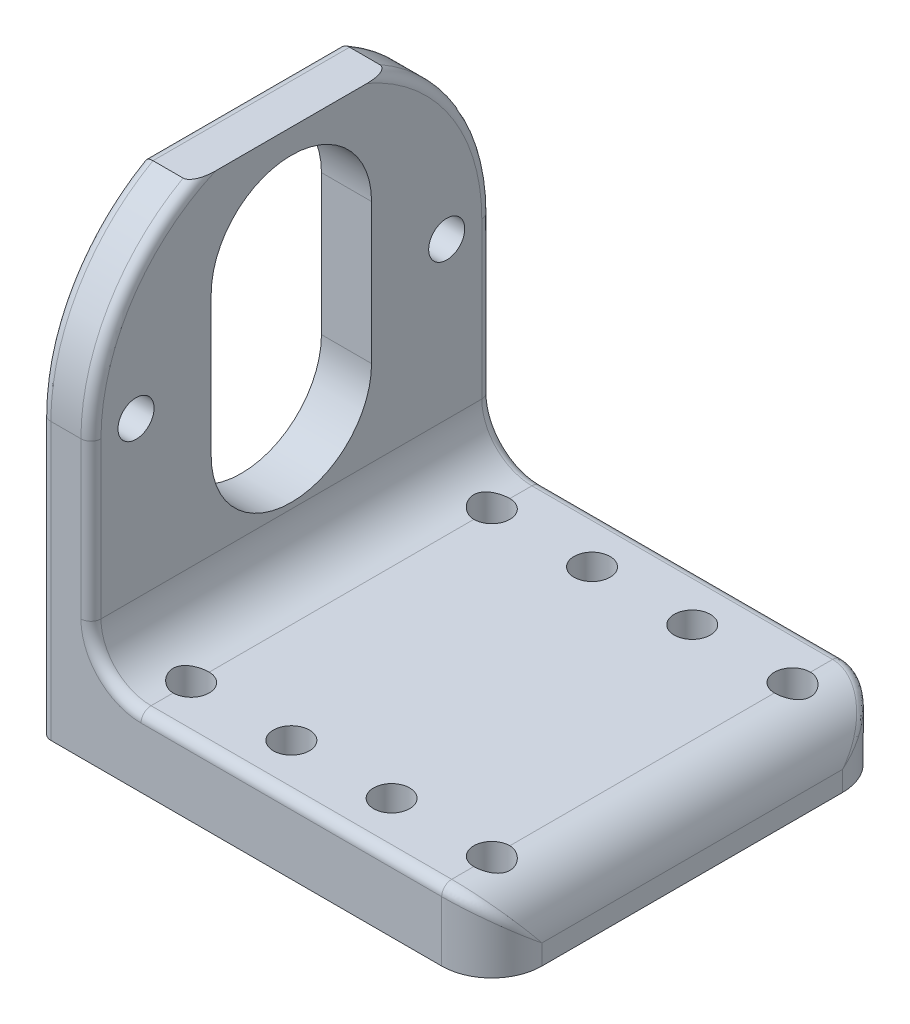
from build123d import *

# Parameters (mm, degrees)
SKETCH1_W           = 40
SKETCH1_H           = 40
SKETCH1_R           = 1.8
BOSS_EXTRUDE1_DEPTH = 7
SKETCH1_3_W         = 5
SKETCH1_3_H         = 40
BOSS_EXTRUDE2_DEPTH = 45
SKETCH2_R           = 1.8
CUT_EXTRUDE1_DEPTH  = 67.708320321
SKETCH2_4_OUTSIDE_W = 57.034
SKETCH2_4_OUTSIDE_H = 62.034
SKETCH2_4_OUTSIDE_R = 1.8
CUT_EXTRUDE2_DEPTH  = 67.708320321
FILLET1_R           = 5
FILLET2_R           = 5
FILLET3_R           = 1


with BuildPart() as part:
    # Sketch1 → Boss-Extrude1 (new body)
    with BuildSketch(Plane(origin=(0, 0, 0), x_dir=(1, 0, 0), z_dir=(0, 1, 0))):
        Rectangle(SKETCH1_W, SKETCH1_H)
        with Locations(Location((-5, -15, 0), (0, 0, 270))):
            Circle(SKETCH1_R, mode=Mode.SUBTRACT)
        with Locations(Location((15, -15, 0), (0, 0, 270))):
            Circle(SKETCH1_R, mode=Mode.SUBTRACT)
        with Locations(Location((-15, 15, 0), (0, 0, 270))):
            Circle(SKETCH1_R, mode=Mode.SUBTRACT)
        with Locations(Location((-5, 15, 0), (0, 0, 270))):
            Circle(SKETCH1_R, mode=Mode.SUBTRACT)
        with Locations(Location((5, 15, 0), (0, 0, 270))):
            Circle(SKETCH1_R, mode=Mode.SUBTRACT)
        with Locations(Location((15, 15, 0), (0, 0, 270))):
            Circle(SKETCH1_R, mode=Mode.SUBTRACT)
        with Locations(Location((5, -15, 0), (0, 0, 270))):
            Circle(SKETCH1_R, mode=Mode.SUBTRACT)
        with Locations(Location((-15, -15, 0), (0, 0, 270))):
            Circle(SKETCH1_R, mode=Mode.SUBTRACT)
    extrude(amount=BOSS_EXTRUDE1_DEPTH)

    # Sketch1<3> → Boss-Extrude2 (add)
    with BuildSketch(Plane(origin=(0, 0, 0), x_dir=(1, 0, 0), z_dir=(0, 1, 0))):
        with Locations((-22.5, 0)):
            Rectangle(SKETCH1_3_W, SKETCH1_3_H)
    extrude(amount=BOSS_EXTRUDE2_DEPTH)

    # Sketch2 → Cut-Extrude1 (cut, through all)
    with BuildSketch(Plane.ZY.offset(25)):
        with Locations((-15.5, 27.569)):
            Circle(SKETCH2_R)
        with BuildLine():
            Line((8, 20.569), (8, 34.569))
            ThreePointArc((8, 34.569), (0, 42.569), (-8, 34.569))
            Line((-8, 34.569), (-8, 20.569))
            ThreePointArc((-8, 20.569), (0, 12.569), (8, 20.569))
        make_face()
        with Locations((15.5, 27.569)):
            Circle(SKETCH2_R)
    extrude(amount=-CUT_EXTRUDE1_DEPTH, mode=Mode.SUBTRACT)

    # Sketch2<4> outside → Cut-Extrude2 (cut, through all)
    # profile 1 of 4: a face of its own
    with BuildSketch(Plane.ZY.offset(25)):
        with Locations((0, 22.5)):
            Rectangle(SKETCH2_4_OUTSIDE_W, SKETCH2_4_OUTSIDE_H)
        with BuildLine():
            Line((-20, 27.569), (-20, 0))
            Line((-20, 0), (20, 0))
            Line((20, 0), (20, 27.569))
            ThreePointArc((20, 27.569), (0, 47.569), (-20, 27.569))
        make_face(mode=Mode.SUBTRACT)
    # profile 2 of 4: a face of its own
    with BuildSketch(Plane.ZY.offset(25)):
        with Locations((-15.5, 27.569)):
            Circle(SKETCH2_4_OUTSIDE_R)
    # profile 3 of 4: a face of its own
    with BuildSketch(Plane.ZY.offset(25)):
        with Locations((15.5, 27.569)):
            Circle(SKETCH2_4_OUTSIDE_R)
    # profile 4 of 4: a face of its own
    with BuildSketch(Plane.ZY.offset(25)):
        with BuildLine():
            Line((-8, 20.569), (-8, 34.569))
            ThreePointArc((-8, 34.569), (0, 42.569), (8, 34.569))
            Line((8, 34.569), (8, 20.569))
            ThreePointArc((8, 20.569), (0, 12.569), (-8, 20.569))
        make_face()
    extrude(amount=-CUT_EXTRUDE2_DEPTH, mode=Mode.SUBTRACT)

    # Fillet1
    # the kernel refuses this fillet: 5 mm, written as the material it adds along each edge
    with BuildSketch(Plane(origin=(-20, 7, -20), x_dir=(1, 0, 0), z_dir=(0, 0, 1))) as fillet1_piece_1_section:
        with BuildLine():
            CenterArc((FILLET1_R, FILLET1_R), FILLET1_R, 180, 90)
            Line((0, FILLET1_R), (0, 0))
            Line((0, 0), (FILLET1_R, 0))
        make_face()
    fillet1_piece_1 = extrude(amount=40, mode=Mode.PRIVATE)
    fillet1_piece_1 = fillet1_piece_1 - Plane(origin=(-15, 8.140202128, -15), x_dir=(0, 0, 1), z_dir=(0, -1, 0)) * Cylinder(1.8, 100, mode=Mode.PRIVATE)
    fillet1_piece_1 = fillet1_piece_1 - Plane(origin=(-15, 8.140202128, 15), x_dir=(0, 0, 1), z_dir=(0, -1, 0)) * Cylinder(1.8, 100, mode=Mode.PRIVATE)
    add(fillet1_piece_1)

    # Fillet2
    # the kernel refuses this fillet: 5 mm, written as the material it takes off along each edge
    with BuildSketch(Plane(origin=(20, -12.5, -20), x_dir=(-1, 0, 0), z_dir=(0, 1, 0)), Plane(origin=(20, -12.5, 20), x_dir=(0, 0, -1), z_dir=(0, 1, 0))) as fillet2_piece_1:
        with BuildLine():
            CenterArc((FILLET2_R, FILLET2_R), FILLET2_R, 180, 90)
            Line((0, FILLET2_R), (0, 0))
            Line((0, 0), (FILLET2_R, 0))
        make_face()
    extrude(amount=32, mode=Mode.SUBTRACT)
    with BuildSketch(Plane(origin=(20, 7, 32.5), x_dir=(-1, 0, 0), z_dir=(0, 0, -1))) as fillet2_piece_2:
        with BuildLine():
            CenterArc((FILLET2_R, -FILLET2_R), FILLET2_R, 90, 90)
            Line((0, -FILLET2_R), (0, 0))
            Line((0, 0), (FILLET2_R, 0))
        make_face()
    extrude(amount=65, mode=Mode.SUBTRACT)

    # Fillet3
    fillet3_edges = [part.edges().sort_by_distance(p)[0] for p in [
        (-20, 37.665468331, -17.264452706),
        (-20, 37.665468331, 17.264452706),
        (0, 7, 20),
        (0, 7, -20),
        (-18.535533906, 8.464466094, -20),
        (-18.535533906, 8.464466094, 20),
        (18.816480084, 5.230244537, 18.230244537),
        (18.816480084, 5.230244537, -18.230244537),
        (-25, 45, 0),
        (-25, 13.7845, -20),
        (-20, 19.7845, -20),
        (-20, 19.7845, 20),
        (-25, 13.7845, 20),
        (-25, 37.665468331, -17.264452706),
        (-25, 37.665468331, 17.264452706),
    ]]
    fillet(fillet3_edges, radius=FILLET3_R)


solid = part.part
